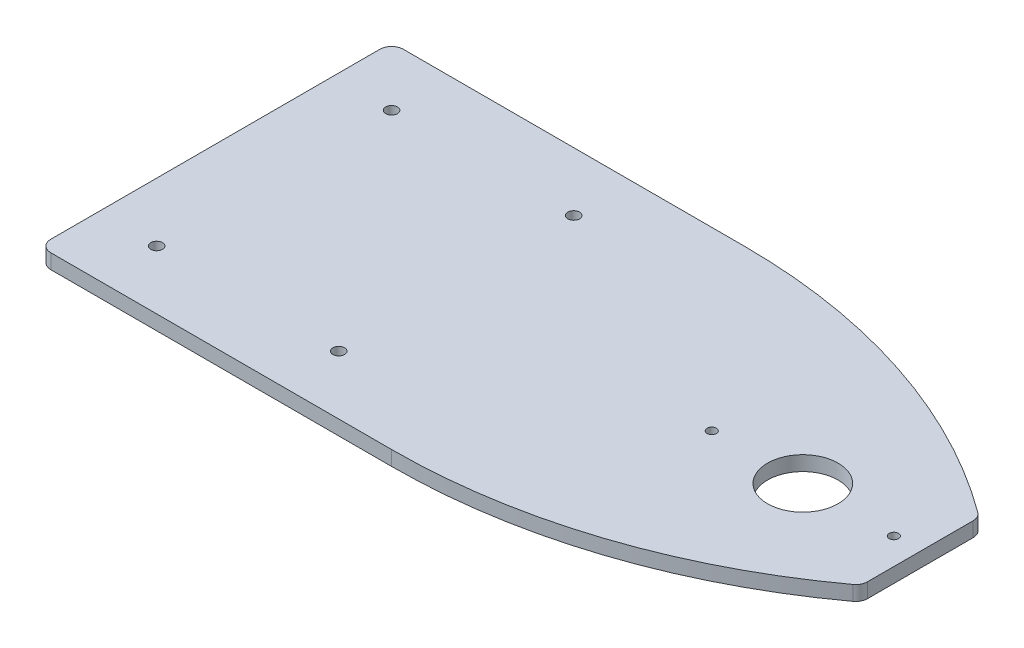
from build123d import *

# Parameters (mm, degrees)
SKETCH1_W           = 152.4
SKETCH1_H           = 76.2
BOSS_EXTRUDE1_DEPTH = 3.175
CUT_EXTRUDE1_DEPTH  = 3.175
FILLET2_R           = 2.54
FILLET3_R           = 2.54
SKETCH5_R           = 7.62
CUT_EXTRUDE2_DEPTH  = 3.175
SKETCH6_R           = 1.27
CUT_EXTRUDE3_DEPTH  = 3.175
SKETCH7_R           = 1.0033
CUT_EXTRUDE4_DEPTH  = 86.253332046


with BuildPart() as part:
    # Sketch1 → Boss-Extrude1 (new body)
    with BuildSketch(Plane(origin=(0, 0, 0), x_dir=(1, 0, 0), z_dir=(0, 1, 0))):
        Rectangle(SKETCH1_W, SKETCH1_H)
    extrude(amount=BOSS_EXTRUDE1_DEPTH)

    # Sketch4 → Cut-Extrude1 (cut)
    with BuildSketch(Plane(origin=(0, 3.175, 0), x_dir=(1, 0, 0), z_dir=(0, 1, 0))):
        with BuildLine():
            Line((0, 38.1), (76.2, 38.1))
            Line((76.2, 38.1), (76.2, 12.7))
            ThreePointArc((76.2, 12.7), (40.160926284, 31.582778852), (0, 38.1))
        make_face()
        with BuildLine():
            Line((76.2, -38.1), (76.2, -12.7))
            ThreePointArc((76.2, -12.7), (40.160926284, -31.582778852), (0, -38.1))
            Line((0, -38.1), (76.2, -38.1))
        make_face()
    extrude(amount=-CUT_EXTRUDE1_DEPTH, mode=Mode.SUBTRACT)

    # Fillet2
    fillet2_edges = [part.edges().sort_by_distance(p)[0] for p in [
        (76.2, 1.5875, 12.7),
        (76.2, 1.5875, -12.7),
    ]]
    fillet(fillet2_edges, radius=FILLET2_R)

    # Fillet3
    fillet3_edges = [part.edges().sort_by_distance(p)[0] for p in [
        (-76.2, 1.5875, 38.1),
        (-76.2, 1.5875, -38.1),
    ]]
    fillet(fillet3_edges, radius=FILLET3_R)

    # Sketch5 → Cut-Extrude2 (cut)
    with BuildSketch(Plane(origin=(0, 3.175, 0), x_dir=(1, 0, 0), z_dir=(0, 1, 0))):
        with Locations((50.8, 0)):
            Circle(SKETCH5_R)
    extrude(amount=-CUT_EXTRUDE2_DEPTH, mode=Mode.SUBTRACT)

    # Sketch6 → Cut-Extrude3 (cut)
    with BuildSketch(Plane(origin=(0, 3.175, 0), x_dir=(1, 0, 0), z_dir=(0, 1, 0))):
        with Locations((-63.5, 25.4)):
            Circle(SKETCH6_R)
        with Locations((-63.5, -25.4)):
            Circle(SKETCH6_R)
        with Locations((-24.13, 25.4)):
            Circle(SKETCH6_R)
        with Locations((-24.13, -25.4)):
            Circle(SKETCH6_R)
    extrude(amount=-CUT_EXTRUDE3_DEPTH, mode=Mode.SUBTRACT)

    # Sketch7 → Cut-Extrude4 (cut, through all)
    with BuildSketch(Plane(origin=(0, 3.175, 0), x_dir=(1, 0, 0), z_dir=(0, 1, 0))):
        with Locations((70.485, 0)):
            Circle(SKETCH7_R)
        with Locations((31.115, 0)):
            Circle(SKETCH7_R)
    extrude(amount=-CUT_EXTRUDE4_DEPTH, mode=Mode.SUBTRACT)


solid = part.part
